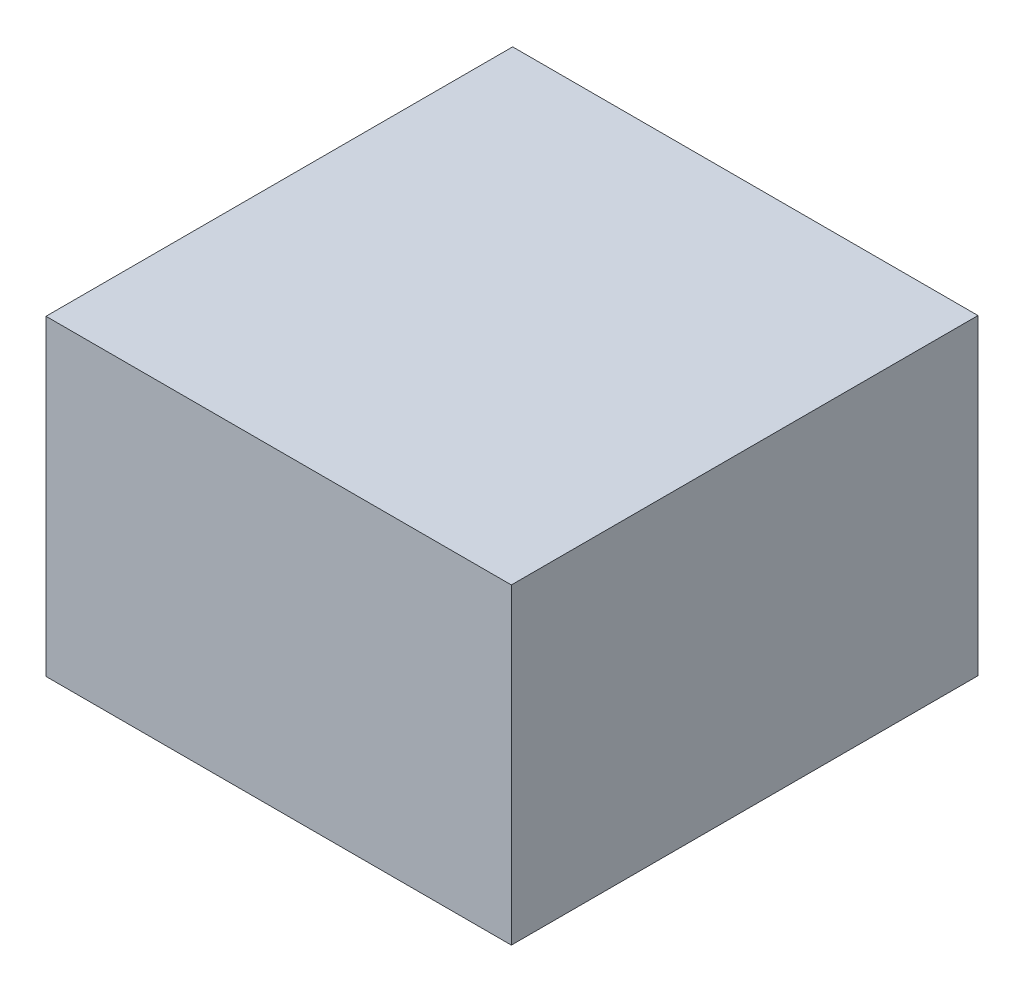
from build123d import *

# Parameters (mm, degrees)
SKETCH2_W           = 914.4
SKETCH2_H           = 609.6
BOSS_EXTRUDE1_DEPTH = 914.4
SHELL2_T            = 2.54


with BuildPart() as part:
    # Sketch2 → Boss-Extrude1 (new body)
    with BuildSketch(Plane.XY):
        with Locations((0, 304.8)):
            Rectangle(SKETCH2_W, SKETCH2_H)
    extrude(amount=BOSS_EXTRUDE1_DEPTH)

    # Shell2
    shell2_openings = [part.faces().sort_by_distance(p)[0] for p in [
        (-457.2, 304.8, 457.2),
    ]]
    offset(amount=SHELL2_T, openings=shell2_openings, kind=Kind.INTERSECTION)


solid = part.part
